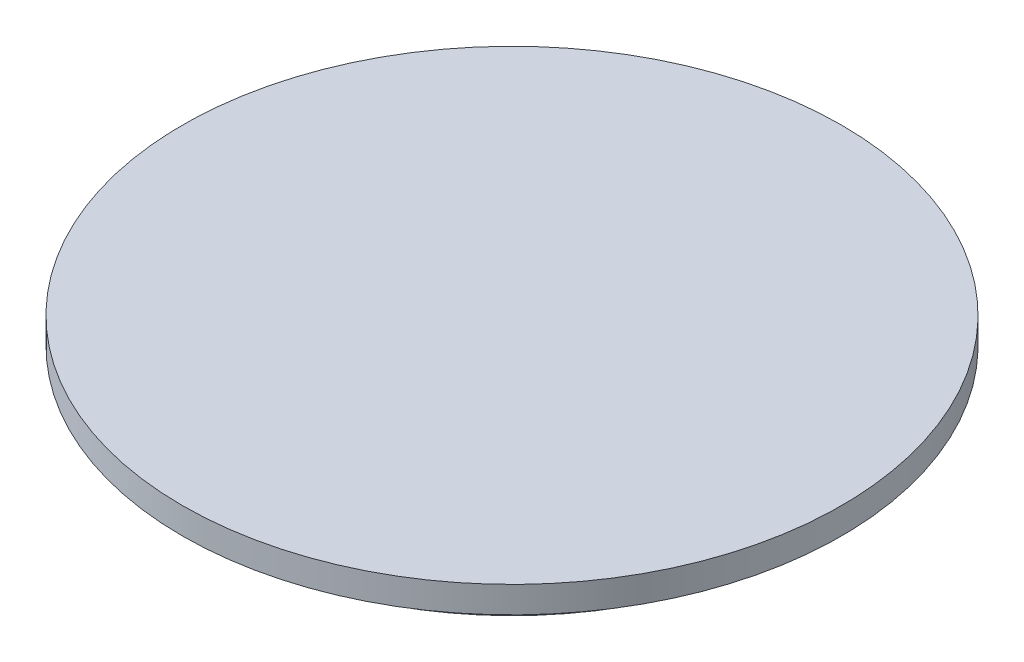
from build123d import *


with BuildPart() as part:
    # Esquisse2 → Révolution1 (revolve)
    with BuildSketch(Plane.XY):
        Polygon((0, 0), (8.9, 0), (8.9, 0.8), (10, 0.8), (10, 1.6), (0, 1.6), align=None)
    revolve(axis=Axis((0, 1.6, 0), (0, -1, 0)))


solid = part.part
